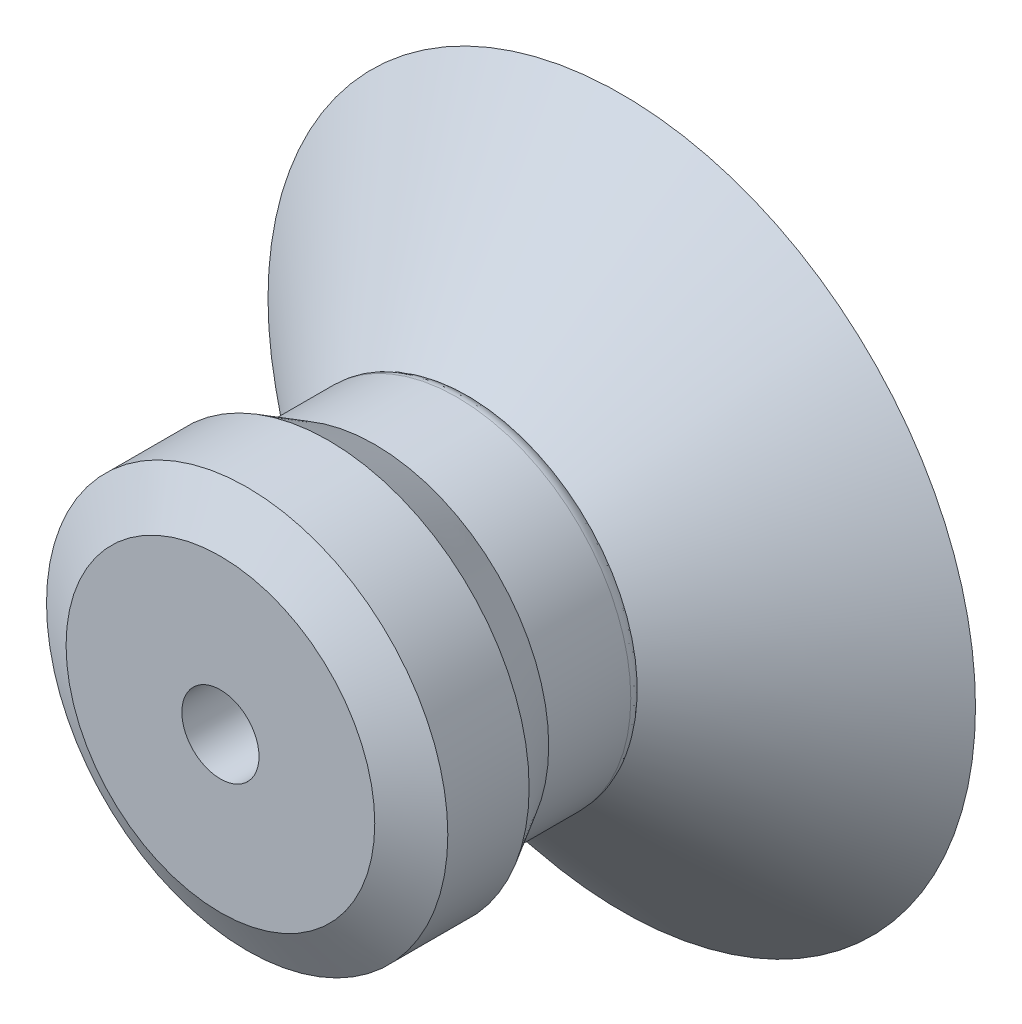
from build123d import *

# Parameters (mm, degrees)
SKETCH56_R           = 6.5
BOSS_EXTRUDE10_DEPTH = 5
CHAMFER1_SIZE        = 1.5
CHAMFER1_SIZE2       = 0.866025404
CHAMFER2_SIZE        = 1.5
CHAMFER2_SIZE2       = 0.866025404
SKETCH59_R           = 5.633974596
BOSS_EXTRUDE12_DEPTH = 3
SKETCH60_R           = 5.5
BOSS_EXTRUDE13_DEPTH = 5
BOSS_EXTRUDE13_DRAFT = -50
SKETCH64_R           = 1.25
CUT_EXTRUDE3_DEPTH   = 53
FILLET3_R            = 0.5
SCALE1_SCALE         = 5


with BuildPart() as part:
    # Sketch56 → Boss-Extrude10 (new body)
    with BuildSketch(Plane(origin=(0, 0, -24.5), x_dir=(-1, 0, 0), z_dir=(0, 0, -1))):
        Circle(SKETCH56_R)
    extrude(amount=BOSS_EXTRUDE10_DEPTH)

    # Chamfer1
    chamfer1_edges = [part.edges().sort_by_distance(p)[0] for p in [
        (6.5, 0, -24.5),
    ]]
    chamfer1_side = [part.faces().sort_by_distance(p)[0] for p in [
        (0, 0, -24.5),
    ]]
    chamfer(chamfer1_edges, length=CHAMFER1_SIZE, length2=CHAMFER1_SIZE2, reference=chamfer1_side[0])

    # Chamfer2
    chamfer2_edges = [part.edges().sort_by_distance(p)[0] for p in [
        (6.5, 0, -29.5),
    ]]
    chamfer2_side = [part.faces().sort_by_distance(p)[0] for p in [
        (6.5, 0, -27.433012702),
    ]]
    chamfer(chamfer2_edges, length=CHAMFER2_SIZE, length2=CHAMFER2_SIZE2, reference=chamfer2_side[0])

    # Sketch59 → Boss-Extrude12 (add)
    with BuildSketch(Plane(origin=(0, 0, -29.5), x_dir=(-1, 0, 0), z_dir=(0, 0, -1))):
        with Locations(Location((0, 0, 0), (0, 0, 180))):
            Circle(SKETCH59_R)
    extrude(amount=BOSS_EXTRUDE12_DEPTH)


with BuildPart() as boss_extrude13_tool:
    # Sketch60 → Boss-Extrude13 (with draft: the straight prism first)
    with BuildSketch(Plane(origin=(0, 0, -32.5), x_dir=(-1, 0, 0), z_dir=(0, 0, -1))):
        Circle(SKETCH60_R)
    extrude(amount=BOSS_EXTRUDE13_DEPTH)
    # Boss-Extrude13: the draft: its side faces are tilted about the plane it starts from
    boss_extrude13_sides = [boss_extrude13_tool.faces().sort_by_distance(p)[0] for p in [
        (5.5, 0, -35),
    ]]
    draft(boss_extrude13_sides, Plane(origin=(0, 0, -32.5), x_dir=(-1, 0, 0), z_dir=(0, 0, -1)), BOSS_EXTRUDE13_DRAFT)


with BuildPart() as part_1:
    add(part.part)

    # Boss-Extrude13: add boss_extrude13_tool
    add(boss_extrude13_tool.part)

    # Sketch62 → Cut-Revolve2 (revolve, cut)
    with BuildSketch(Plane(origin=(0, 0, 0), x_dir=(0, 0, -1), z_dir=(1, 0, 0)), mode=Mode.PRIVATE) as cut_revolve2_sk:
        Polygon((32.5, 0), (37.5, 10.922090923), (37.5, 0), align=None)
    revolve(cut_revolve2_sk.sketch.rotate(Axis((0, 0, -32.5), (0, 0, -1)), 90), axis=Axis((0, 0, -32.5), (0, 0, -1)), mode=Mode.SUBTRACT)

    # Sketch64 → Cut-Extrude3 (cut)
    with BuildSketch(Plane.XY.offset(-24.5)):
        Circle(SKETCH64_R)
    extrude(amount=-CUT_EXTRUDE3_DEPTH, mode=Mode.SUBTRACT)

    # Fillet3
    # the kernel refuses this fillet: 0.5 mm, written as the material it takes off along each edge
    with BuildSketch(Plane(origin=(0, 0, -32.5), x_dir=(1, 0, 0), z_dir=(0, 1, 0))) as fillet3_piece_1:
        with BuildLine():
            CenterArc((5.133974596, -0.340625019), FILLET3_R, 0, 42.941402865)
            Line((5.5, 0), (5.633974596, 0))
            Line((5.633974596, 0), (5.633974596, -0.340625019))
        make_face()
    revolve(axis=Axis((0, 0, -32.5), (0, 0, -1)), mode=Mode.SUBTRACT)


with BuildPart() as part_2:
    # Scale1: scaled about (0, 0, -30.8088706)
    add(part_1.part.scale(SCALE1_SCALE).moved(Location((0, 0, 123.2354824))))


solid = part_2.part
